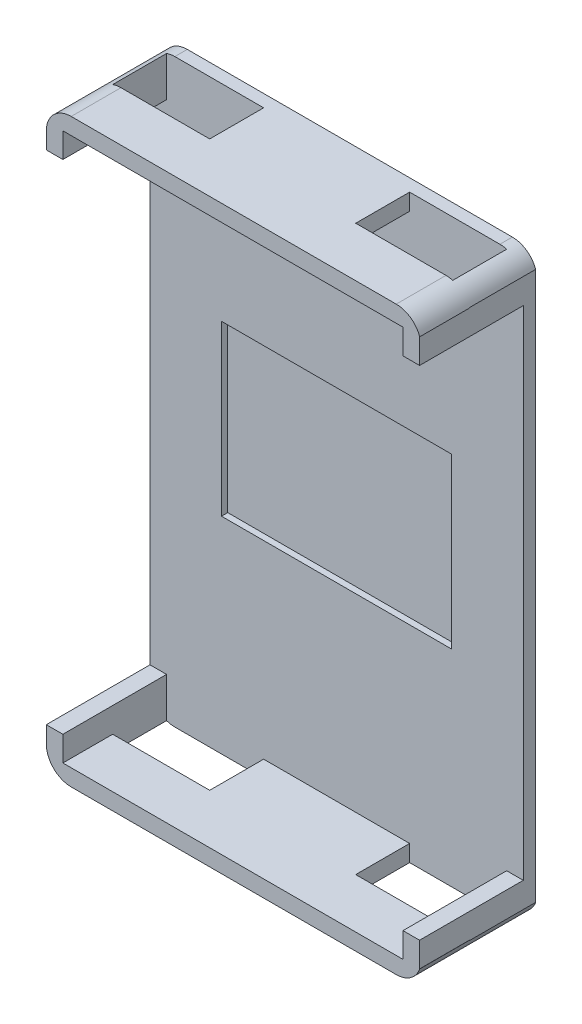
from build123d import *

# Parameters (mm, degrees)
SKETCH1_W           = 140
SKETCH1_H           = 90
BOSS_EXTRUDE1_DEPTH = 3
SKETCH2_W           = 4
SKETCH2_H           = 4
SKETCH2_W_2         = 35.2
BOSS_EXTRUDE2_DEPTH = 25
SKETCH4_W           = 55.5
SKETCH4_H           = 40.7
CUT_EXTRUDE1_DEPTH  = 1.5
SKETCH5_W           = 90.034346747
SKETCH5_H           = 4
SKETCH5_W_2         = 90.027377931
BOSS_EXTRUDE3_DEPTH = 12
SKETCH8_W           = 4
SKETCH8_H           = 10
BOSS_EXTRUDE5_DEPTH = 25
FILLET1_START       = -1
FILLET1_DEPTH       = 29


with BuildPart() as part:
    # Sketch1 → Boss-Extrude1 (new body)
    with BuildSketch(Plane(origin=(0, 0, 0), x_dir=(0, 1, 0), z_dir=(0, 0, 1))):
        Rectangle(SKETCH1_W, SKETCH1_H)
    extrude(amount=BOSS_EXTRUDE1_DEPTH)

    # Sketch2 → Boss-Extrude2 (add)
    with BuildSketch(Plane.XY.offset(3)):
        with Locations((-43, 68)):
            Rectangle(SKETCH2_W, SKETCH2_H)
        with Locations((43, 68)):
            Rectangle(SKETCH2_W, SKETCH2_H)
        with Locations((43, -68)):
            Rectangle(SKETCH2_W, SKETCH2_H)
        with Locations((-43, -68)):
            Rectangle(SKETCH2_W, SKETCH2_H)
        with Locations((0, 68)):
            Rectangle(SKETCH2_W_2, SKETCH2_H)
        with Locations((0, -68)):
            Rectangle(SKETCH2_W_2, SKETCH2_H)
    extrude(amount=BOSS_EXTRUDE2_DEPTH)

    # Sketch4 → Cut-Extrude1 (cut)
    with BuildSketch(Plane.XY.offset(3)):
        Rectangle(SKETCH4_W, SKETCH4_H)
    extrude(amount=-CUT_EXTRUDE1_DEPTH, mode=Mode.SUBTRACT)

    # Sketch5 → Boss-Extrude3 (add)
    with BuildSketch(Plane.XY.offset(28)):
        with Locations((0.017173374, -68)):
            Rectangle(SKETCH5_W, SKETCH5_H)
        with Locations((0.013688966, 68)):
            Rectangle(SKETCH5_W_2, SKETCH5_H)
    extrude(amount=-BOSS_EXTRUDE3_DEPTH)

    # Sketch8 → Boss-Extrude5 (add, through all)
    with BuildSketch(Plane.XY.offset(3)):
        with Locations((-43, 65)):
            Rectangle(SKETCH8_W, SKETCH8_H)
        with Locations((43, 65)):
            Rectangle(SKETCH8_W, SKETCH8_H)
        with Locations((43, -65)):
            Rectangle(SKETCH8_W, SKETCH8_H)
        with Locations((-43, -65)):
            Rectangle(SKETCH8_W, SKETCH8_H)
    extrude(amount=BOSS_EXTRUDE5_DEPTH)

    # Fillet1: read off the stored shape, not the designer's step
    # Fillet1 outline → Fillet1 (cut)
    with BuildSketch(Plane.XY.offset(FILLET1_START)):
        with BuildLine():
            Line((45.027377931, 66), (45.027377931, 70))
            Line((45.027377931, 70), (39.370523681, 70))
            ThreePointArc((39.370523681, 70), (42.834625296, 68.898979486), (45.027377931, 66))
        make_face()
        with BuildLine():
            Line((45.034346747, -70), (45.034346747, -66))
            ThreePointArc((45.034346747, -66), (42.841594113, -68.898979486), (39.377492498, -70))
            Line((39.377492498, -70), (45.034346747, -70))
        make_face()
        with BuildLine():
            Line((-39, 70), (-45, 70))
            Line((-45, 70), (-45, 64))
            ThreePointArc((-45, 64), (-43.242640687, 68.242640687), (-39, 70))
        make_face()
        with BuildLine():
            ThreePointArc((-39, -70), (-43.242640687, -68.242640687), (-45, -64))
            Line((-45, -64), (-45, -70))
            Line((-45, -70), (-39, -70))
        make_face()
    extrude(amount=FILLET1_DEPTH, mode=Mode.SUBTRACT)


solid = part.part
